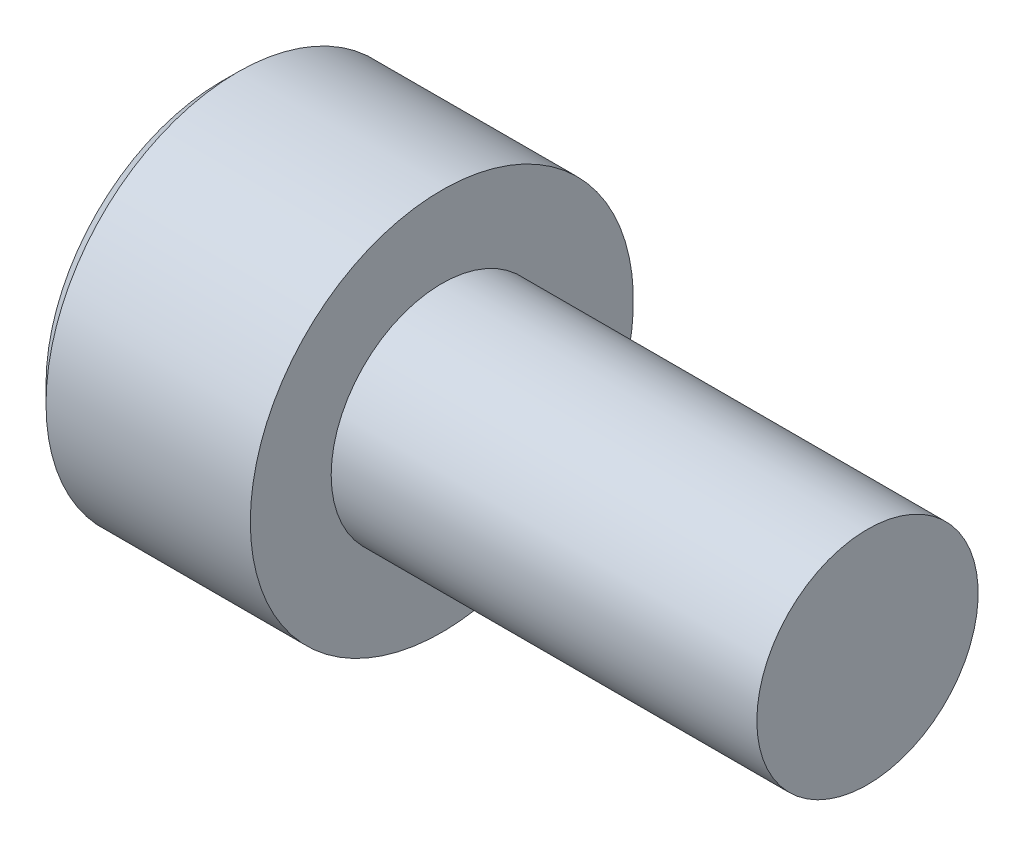
from build123d import *

# Parameters (mm, degrees)
CHAMFER1_SIZE      = 0.2
CUT_EXTRUDE1_DEPTH = 1.1


with BuildPart() as part:
    # Sketch1 → Revolve1 (revolve)
    with BuildSketch(Plane.XY):
        Polygon((-2.6, 0), (5, 0), (5, 1.3), (0, 1.3), (0, 2.25), (-2.6, 2.25), align=None)
    revolve(axis=Axis((-2.6, 0, 0), (1, 0, 0)))

    # Chamfer1
    chamfer1_edges = [part.edges().sort_by_distance(p)[0] for p in [
        (-2.6, -2.25, 0),
    ]]
    chamfer(chamfer1_edges, length=CHAMFER1_SIZE)

    # Sketch2 → Cut-Revolve1 (revolve, cut)
    with BuildSketch(Plane.XY):
        Polygon((-0.899139381, 0), (-1.5, 1), (-2.6, 1), (-2.6, 0), align=None)
    revolve(axis=Axis((-2.6, 0, 0), (1, 0, 0)), mode=Mode.SUBTRACT)

    # Sketch3 → Cut-Extrude1 (cut)
    with BuildSketch(Plane.ZY.offset(2.6)):
        Polygon((0, -1.154700538), (1, -0.577350269), (1, 0.577350269), (0, 1.154700538), (-1, 0.577350269), (-1, -0.577350269), align=None)
    extrude(amount=-CUT_EXTRUDE1_DEPTH, mode=Mode.SUBTRACT)


solid = part.part
